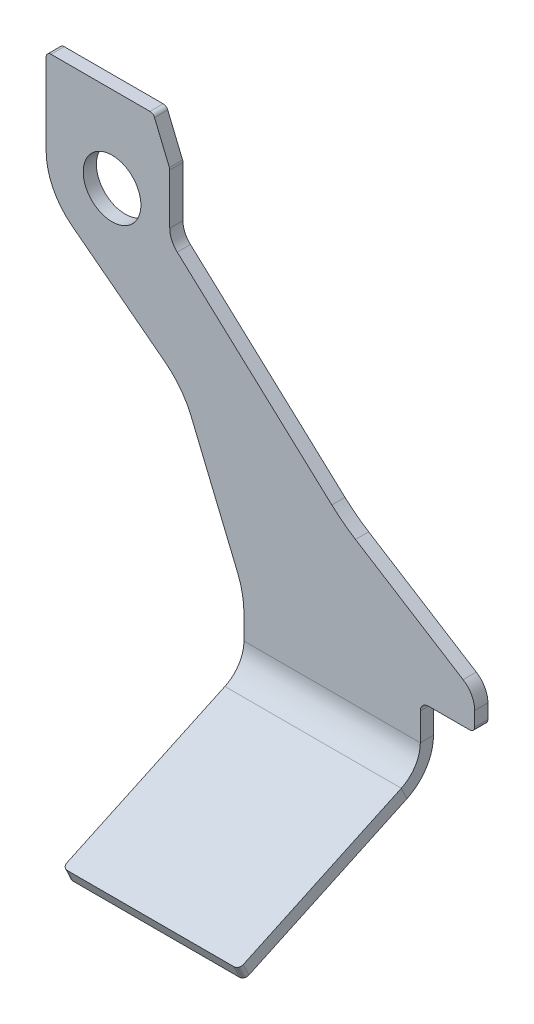
from build123d import *

# Parameters (mm, degrees)
SKETCH1_R              = 17.5
BASE_EXTRUDE_DEPTH     = 8
PROCESS_BENDS2_START   = 80
PROCESS_BENDS2_DEPTH   = 107
PROCESS_BENDS2_2_DEPTH = 107
PROCESS_BENDS2_START_2 = -200
PROCESS_BENDS2_3_DEPTH = 34.194961468


with BuildPart() as part:
    # Sketch1 → Base-Extrude (new body)
    with BuildSketch(Plane.XY):
        with BuildLine():
            Line((-24.35045716, -31.734133612), (32.213121298, -75.1368939))
            ThreePointArc((32.213121298, -75.1368939), (41.442716862, -84.366489464), (47.969026473, -95.670389296))
            Line((47.969026473, -95.670389296), (76.193976626, -163.811446751))
            ThreePointArc((76.193976626, -163.811446751), (79.03926402, -173.191102268), (80, -182.945618369))
            Line((80, -182.945618369), (80, -330))
            ThreePointArc((80, -330), (80.878679656, -332.121320344), (83, -333))
            Line((83, -333), (184, -333))
            ThreePointArc((184, -333), (186.121320344, -332.121320344), (187, -330))
            Line((187, -330), (187, -181))
            ThreePointArc((187, -181), (188.464466094, -177.464466094), (192, -176))
            Line((192, -176), (217, -176))
            ThreePointArc((217, -176), (219.121320344, -175.121320344), (220, -173))
            Line((220, -173), (220, -164.288637004))
            ThreePointArc((220, -164.288637004), (218.128933039, -157.033906323), (212.9825177, -151.589053894))
            Line((212.9825177, -151.589053894), (147.666248084, -110.53351106))
            ThreePointArc((147.666248084, -110.53351106), (140.248070405, -105.389440946), (133.324011991, -99.597357342))
            Line((133.324011991, -99.597357342), (39.541737093, -13.661735283))
            ThreePointArc((39.541737093, -13.661735283), (36.185639292, -8.978306226), (35, -3.339852568))
            Line((35, -3.339852568), (35, 27.261127274))
            ThreePointArc((35, 27.261127274), (34.942355841, 27.84639824), (34.771638598, 28.409177571))
            Line((34.771638598, 28.409177571), (25.767102684, 50.148050297))
            ThreePointArc((25.767102684, 50.148050297), (24.662174785, 51.494408837), (22.995464086, 52))
            Line((22.995464086, 52), (-37, 52))
            ThreePointArc((-37, 52), (-39.121320344, 51.121320344), (-40, 49))
            Line((-40, 49), (-40, 0))
            ThreePointArc((-40, 0), (-35.874909661, -17.691547609), (-24.35045716, -31.734133612))
        make_face()
        Circle(SKETCH1_R, mode=Mode.SUBTRACT)
    extrude(amount=-BASE_EXTRUDE_DEPTH)

    # Process-Bends2: read off the stored shape, not the designer's step
    # Process-Bends2 outline → Process-Bends2 (cut)
    with BuildSketch(Plane.YZ.offset(PROCESS_BENDS2_START)):
        with BuildLine():
            ThreePointArc((-197.729039967, -8), (-208.312045211, -5.922962794), (-217.324957909, 0))
            Line((-217.324957909, 0), (-333, 0))
            Line((-333, 0), (-333, -8))
            Line((-333, -8), (-197.729039967, -8))
        make_face()
    extrude(amount=PROCESS_BENDS2_DEPTH, mode=Mode.SUBTRACT)

    # Process-Bends2 2 outline → Process-Bends2 2 (add)
    with BuildSketch(Plane.YZ.offset(PROCESS_BENDS2_START)):
        with BuildLine():
            Line((-215.855195707, 11.547634765), (-261.806073579, 110.089610364))
            Line((-261.806073579, 110.089610364), (-269.056535875, 106.70866427))
            Line((-269.056535875, 106.70866427), (-223.105658004, 8.166688671))
            ThreePointArc((-223.105658004, 8.166688671), (-220.583053817, 3.823039502), (-217.324957909, 0))
            Line((-217.324957909, 0), (-197.729039967, 0))
            ThreePointArc((-197.729039967, 0), (-208.475032134, 3.132171084), (-215.855195707, 11.547634765))
        make_face()
    extrude(amount=PROCESS_BENDS2_2_DEPTH)

    # Process-Bends2 3 outline → Process-Bends2 3 (cut)
    with BuildSketch(Plane(origin=(0, 0, 0), x_dir=(1, 0, 0), z_dir=(0, 0.9063077870366512, 0.42261826174069705)).offset(PROCESS_BENDS2_START_2)):
        with BuildLine():
            Line((80, -210.419098874), (83, -210.419098874))
            ThreePointArc((83, -210.419098874), (80.878679657, -209.540419218), (80, -207.419098874))
            Line((80, -207.419098874), (80, -210.419098874))
        make_face()
        with BuildLine():
            ThreePointArc((187, -207.419098874), (186.121320343, -209.540419218), (184, -210.419098874))
            Line((184, -210.419098874), (187, -210.419098874))
            Line((187, -210.419098874), (187, -207.419098874))
        make_face()
    extrude(amount=PROCESS_BENDS2_3_DEPTH, mode=Mode.SUBTRACT)


solid = part.part
